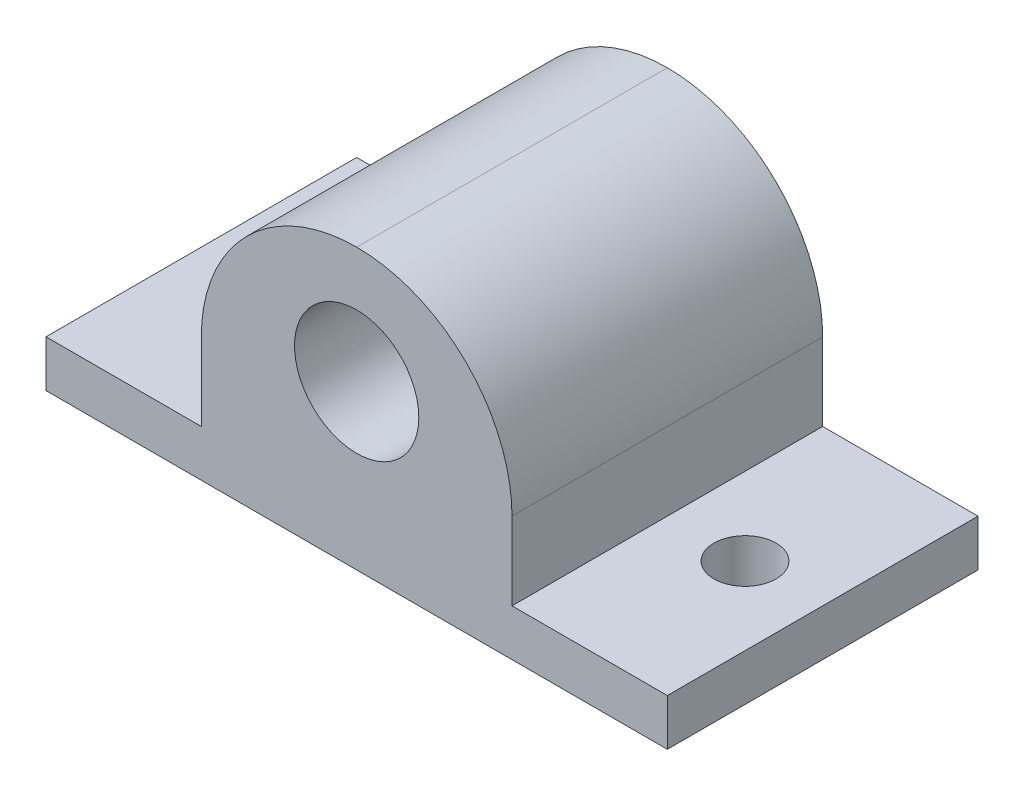
from build123d import *

# Parameters (mm, degrees)
SKETCH1_W           = 40
SKETCH1_H           = 20
BOSS_EXTRUDE1_DEPTH = 3
SKETCH2_W           = 20
SKETCH2_H           = 20
BOSS_EXTRUDE2_DEPTH = 15
SKETCH3_R           = 4
CUT_EXTRUDE1_DEPTH  = 49.207883173
FILLET1_R           = 10
SKETCH4_R           = 2
CUT_EXTRUDE2_DEPTH  = 48.16990566


with BuildPart() as part:
    # Sketch1 → Boss-Extrude1 (new body)
    with BuildSketch(Plane(origin=(0, 0, 0), x_dir=(1, 0, 0), z_dir=(0, 1, 0))):
        with Locations((20, 10)):
            Rectangle(SKETCH1_W, SKETCH1_H)
    extrude(amount=BOSS_EXTRUDE1_DEPTH)

    # Sketch2 → Boss-Extrude2 (add)
    with BuildSketch(Plane(origin=(0, 3, 0), x_dir=(1, 0, 0), z_dir=(0, 1, 0))):
        with Locations((20, 10)):
            Rectangle(SKETCH2_W, SKETCH2_H)
    extrude(amount=BOSS_EXTRUDE2_DEPTH)

    # Sketch3 → Cut-Extrude1 (cut, through all)
    with BuildSketch(Plane.XY):
        with Locations((20, 10.5)):
            Circle(SKETCH3_R)
    extrude(amount=-CUT_EXTRUDE1_DEPTH, mode=Mode.SUBTRACT)

    # Fillet1
    fillet1_edges = [part.edges().sort_by_distance(p)[0] for p in [
        (30, 18, -10),
        (10, 18, -10),
    ]]
    fillet(fillet1_edges, radius=FILLET1_R - 0.0001)  # a hair under: the kernel refuses the full size

    # Sketch4 → Cut-Extrude2 (cut, through all)
    with BuildSketch(Plane(origin=(0, 3, 0), x_dir=(1, 0, 0), z_dir=(0, 1, 0))):
        with Locations(Location((35, 10, 0), (0, 0, 270))):
            Circle(SKETCH4_R)
        with Locations(Location((5, 10, 0), (0, 0, 270))):
            Circle(SKETCH4_R)
    extrude(amount=-CUT_EXTRUDE2_DEPTH, mode=Mode.SUBTRACT)


solid = part.part
